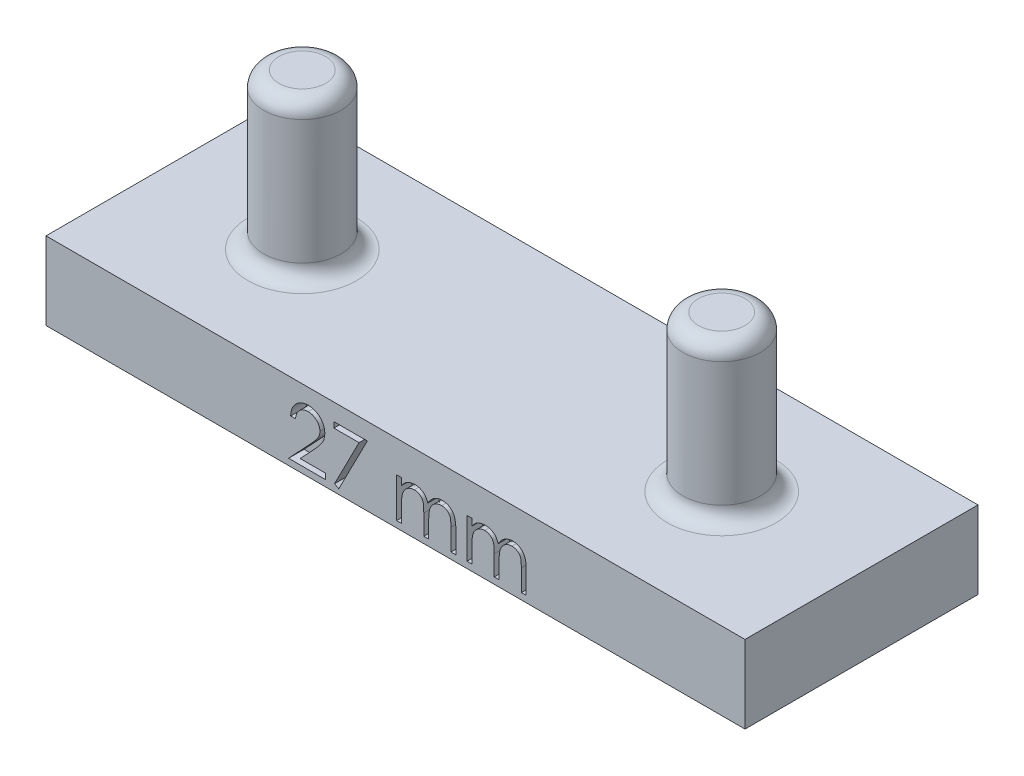
from build123d import *

# Parameters (mm, degrees)
SKETCH1_R             = 2.5
BOSS_EXTRUDE1_DEPTH   = 10
BOSS_EXTRUDE1_2_DEPTH = 10
SKETCH2_W             = 45
SKETCH2_H             = 15
BOSS_EXTRUDE2_DEPTH   = 5
CUT_EXTRUDE1_DEPTH    = 1
FILLET1_R             = 1


with BuildPart() as part:
    # Sketch1 → Boss-Extrude1 (new body)
    with BuildSketch(Plane(origin=(0, 0, 0), x_dir=(1, 0, 0), z_dir=(0, 1, 0))):
        with Locations((-41.821276596, 3.10212766)):
            Circle(SKETCH1_R)
    extrude(amount=BOSS_EXTRUDE1_DEPTH)



with BuildPart() as body_2:
    # Sketch1 → Boss-Extrude1 2 (new body)
    with BuildSketch(Plane(origin=(0, 0, 0), x_dir=(1, 0, 0), z_dir=(0, 1, 0))):
        with Locations((-14.821276596, 3.10212766)):
            Circle(SKETCH1_R)
    extrude(amount=BOSS_EXTRUDE1_2_DEPTH)


with BuildPart() as part_1:
    add(part.part)

    add(body_2.part)  # Boss-Extrude2 merges body 2
    # Sketch2 → Boss-Extrude2 (add)
    with BuildSketch(Plane.XZ):
        with Locations((-28.321276596, -3.10212766)):
            Rectangle(SKETCH2_W, SKETCH2_H)
    extrude(amount=BOSS_EXTRUDE2_DEPTH)

    # Sketch3 → Cut-Extrude1 (cut)
    with BuildSketch(Plane.XY.offset(4.39787234)):
        with BuildLine():
            Line((-23.718209968, -2.034062219), (-23.404107404, -2.034062219))
            Line((-23.404107404, -2.034062219), (-23.404107404, -2.478573436))
            add(Edge.make_bspline(
                [(-23.404107404, -2.478573436), (-23.375823454, -2.439685835), (-23.321628694, -2.365173462), (-23.232763042, -2.266983177), (-23.143986929, -2.183655023), (-23.080053547, -2.139912151), (-23.049339775, -2.118897956)],
                knots=[0, 0, 0, 0, 1.134379233, 2.173579362, 3.122582517, 4, 4, 4, 4], degree=3))
            add(Edge.make_bspline(
                [(-23.049339775, -2.118897956), (-23.007475113, -2.09889259), (-22.924477214, -2.059231377), (-22.793057989, -2.018997818), (-22.658583319, -1.994272717), (-22.567775105, -1.990891343), (-22.522096186, -1.989190424)],
                knots=[0, 0, 0, 0, 1.014936303, 2.012140481, 3.000054389, 4, 4, 4, 4], degree=3))
            add(Edge.make_bspline(
                [(-22.522096186, -1.989190424), (-22.491203189, -1.990235714), (-22.43006761, -1.992304289), (-22.33948352, -2.005764324), (-22.251624908, -2.029030497), (-22.167010879, -2.061437821), (-22.0872902, -2.100684508), (-22.014201002, -2.146734216), (-21.948576794, -2.198431291), (-21.890450742, -2.258110224), (-21.838181717, -2.327446823), (-21.79010287, -2.408311072), (-21.745677658, -2.502518733), (-21.721056349, -2.570885274), (-21.708093782, -2.606878725)],
                knots=[0, 0, 0, 0, 1.009824226, 1.998387844, 2.986035974, 3.974953746, 4.955485308, 5.885931332, 6.793869504, 7.679848016, 8.601185859, 9.625726857, 10.749998409, 12, 12, 12, 12], degree=3))
            add(Edge.make_bspline(
                [(-21.708093782, -2.606878725), (-21.69438253, -2.582154306), (-21.667400713, -2.533500121), (-21.622095076, -2.464641858), (-21.57462728, -2.400235067), (-21.524592787, -2.340228642), (-21.4721682, -2.284918912), (-21.4171068, -2.23412301), (-21.359722018, -2.187622797), (-21.279929778, -2.133299637), (-21.176117171, -2.075598456), (-21.045229056, -2.025570012), (-20.909078885, -1.994653883), (-20.816661186, -1.99102361), (-20.76999282, -1.989190424)],
                knots=[0, 0, 0, 0, 0.86119277, 1.694706429, 2.50939023, 3.298075842, 4.073795165, 4.829715201, 5.57930267, 6.321991688, 7.768977793, 9.186738141, 10.579381044, 12, 12, 12, 12], degree=3))
            add(Edge.make_bspline(
                [(-20.76999282, -1.989190424), (-20.727111357, -1.990807645), (-20.643188171, -1.993972703), (-20.521010906, -2.018826176), (-20.4070691, -2.061503823), (-20.301592024, -2.11973746), (-20.206432211, -2.192916643), (-20.123715901, -2.279985481), (-20.053945538, -2.380328104), (-20.008366898, -2.474720092), (-19.977451634, -2.558055425), (-19.9583904, -2.629061717), (-19.941550705, -2.707213269), (-19.92756946, -2.792603531), (-19.917350907, -2.885534139), (-19.909780192, -2.985853015), (-19.904656118, -3.093638127), (-19.904294046, -3.168003627), (-19.904107404, -3.20633786)],
                knots=[0, 0, 0, 0, 1.209669288, 2.367440248, 3.500751976, 4.631527125, 5.755587489, 6.87532382, 8.007944318, 9.190864318, 9.82315674, 10.514484317, 11.263564316, 12.079023757, 12.955305781, 13.901327259, 14.918167583, 16, 16, 16, 16], degree=3))
            Line((-19.904107404, -3.20633786), (-19.904107404, -4.591754526))
            Line((-19.904107404, -4.591754526), (-20.218209968, -4.591754526))
            Line((-20.218209968, -4.591754526), (-20.218209968, -3.204935616))
            add(Edge.make_bspline(
                [(-20.218209968, -3.204935616), (-20.218287851, -3.172215042), (-20.21843753, -3.109331075), (-20.221131162, -3.019078624), (-20.226206476, -2.936810267), (-20.232141114, -2.862638179), (-20.240384924, -2.79638939), (-20.251030855, -2.738196972), (-20.262308535, -2.68760316), (-20.281044526, -2.631517113), (-20.310992418, -2.569646902), (-20.356609898, -2.502923326), (-20.414080004, -2.444842526), (-20.480440161, -2.394424209), (-20.555988606, -2.353430568), (-20.639253329, -2.324154558), (-20.72971738, -2.30603168), (-20.792340169, -2.304225665), (-20.82468032, -2.303292988)],
                knots=[0, 0, 0, 0, 1.253487763, 2.409012846, 3.458416907, 4.410876679, 5.259312806, 6.014470957, 6.676830364, 7.243083969, 8.276244668, 9.299465089, 10.325150304, 11.392391894, 12.482080715, 13.603491619, 14.762376348, 16, 16, 16, 16], degree=3))
            add(Edge.make_bspline(
                [(-20.82468032, -2.303292988), (-20.864350275, -2.304709145), (-20.942753186, -2.307508011), (-21.057198672, -2.336081884), (-21.167169689, -2.379162134), (-21.269384822, -2.441594591), (-21.363412612, -2.516402955), (-21.44431219, -2.605352551), (-21.511144376, -2.705982478), (-21.556398352, -2.79912918), (-21.584987653, -2.882798624), (-21.603864569, -2.955895996), (-21.61854796, -3.038977564), (-21.632318489, -3.131485055), (-21.641306217, -3.234055235), (-21.64947459, -3.346213636), (-21.653295452, -3.468297596), (-21.653829911, -3.552924284), (-21.654107404, -3.596862699)],
                knots=[0, 0, 0, 0, 1.090531906, 2.155305635, 3.229839962, 4.33261226, 5.44038871, 6.529323825, 7.629011124, 8.757537029, 9.370236727, 10.061839251, 10.834451254, 11.692844982, 12.636905849, 13.66920014, 14.789842145, 16, 16, 16, 16], degree=3))
            Line((-21.654107404, -3.596862699), (-21.654107404, -4.591754526))
            Line((-21.654107404, -4.591754526), (-21.968209968, -4.591754526))
            Line((-21.968209968, -4.591754526), (-21.968209968, -3.291173597))
            add(Edge.make_bspline(
                [(-21.968209968, -3.291173597), (-21.968289399, -3.254480278), (-21.968442216, -3.183886021), (-21.971118533, -3.082652345), (-21.976205155, -2.990571265), (-21.982085703, -2.907749802), (-21.990545882, -2.834338473), (-22.000155644, -2.769943715), (-22.011504254, -2.714726964), (-22.030294139, -2.654163579), (-22.059008607, -2.587442656), (-22.105196869, -2.516301635), (-22.16280445, -2.454033537), (-22.230375326, -2.400874789), (-22.306381008, -2.356933307), (-22.390364409, -2.325273556), (-22.481569321, -2.306849266), (-22.544447027, -2.304500769), (-22.576783686, -2.303292988)],
                knots=[0, 0, 0, 0, 1.320475261, 2.540461679, 3.643808994, 4.639130445, 5.527981419, 6.302341397, 6.981980563, 7.553956391, 8.582137848, 9.585246428, 10.591171744, 11.620968678, 12.668337649, 13.738356861, 14.836885341, 16, 16, 16, 16], degree=3))
            add(Edge.make_bspline(
                [(-22.576783686, -2.303292988), (-22.614799897, -2.304823448), (-22.690564857, -2.3078736), (-22.801866826, -2.335327874), (-22.90935251, -2.378331949), (-23.011307209, -2.437991768), (-23.104981357, -2.511890847), (-23.186989624, -2.598805742), (-23.25593215, -2.697654776), (-23.301663965, -2.789819292), (-23.331162439, -2.871392567), (-23.350757773, -2.940743515), (-23.367597399, -3.017743763), (-23.380111421, -3.102630874), (-23.392191837, -3.194851968), (-23.398022146, -3.294866458), (-23.403693708, -3.402588546), (-23.403966123, -3.476961091), (-23.404107404, -3.515532571)],
                knots=[0, 0, 0, 0, 1.098833095, 2.189935336, 3.297829714, 4.440610912, 5.596351641, 6.740013378, 7.886572111, 9.072425424, 9.705826452, 10.395263256, 11.156850408, 11.985370555, 12.878090359, 13.847760091, 14.883794034, 16, 16, 16, 16], degree=3))
            Line((-23.404107404, -3.515532571), (-23.404107404, -4.591754526))
            Line((-23.404107404, -4.591754526), (-23.718209968, -4.591754526))
            Line((-23.718209968, -4.591754526), (-23.718209968, -2.034062219))
        make_face()
        with BuildLine():
            Line((-28.25026125, -2.034062219), (-27.936158686, -2.034062219))
            Line((-27.936158686, -2.034062219), (-27.936158686, -2.478573436))
            add(Edge.make_bspline(
                [(-27.936158686, -2.478573436), (-27.907874736, -2.439685835), (-27.853679976, -2.365173462), (-27.764814324, -2.266983177), (-27.676038211, -2.183655023), (-27.612104829, -2.139912151), (-27.581391057, -2.118897956)],
                knots=[0, 0, 0, 0, 1.134379233, 2.173579362, 3.122582517, 4, 4, 4, 4], degree=3))
            add(Edge.make_bspline(
                [(-27.581391057, -2.118897956), (-27.539526395, -2.09889259), (-27.456528496, -2.059231377), (-27.325109271, -2.018997818), (-27.190634601, -1.994272717), (-27.099826387, -1.990891343), (-27.054147468, -1.989190424)],
                knots=[0, 0, 0, 0, 1.014936303, 2.012140481, 3.000054389, 4, 4, 4, 4], degree=3))
            add(Edge.make_bspline(
                [(-27.054147468, -1.989190424), (-27.023254471, -1.990235714), (-26.962118892, -1.992304289), (-26.871534802, -2.005764324), (-26.78367619, -2.029030497), (-26.699062161, -2.061437821), (-26.619341482, -2.100684508), (-26.546252284, -2.146734216), (-26.480628076, -2.198431291), (-26.422502024, -2.258110224), (-26.370232999, -2.327446823), (-26.322154152, -2.408311072), (-26.27772894, -2.502518733), (-26.253107631, -2.570885274), (-26.240145064, -2.606878725)],
                knots=[0, 0, 0, 0, 1.009824226, 1.998387844, 2.986035974, 3.974953746, 4.955485308, 5.885931332, 6.793869504, 7.679848016, 8.601185859, 9.625726857, 10.749998409, 12, 12, 12, 12], degree=3))
            add(Edge.make_bspline(
                [(-26.240145064, -2.606878725), (-26.226433813, -2.582154306), (-26.199451995, -2.533500121), (-26.154146358, -2.464641858), (-26.106678562, -2.400235067), (-26.056644069, -2.340228642), (-26.004219482, -2.284918912), (-25.949158082, -2.23412301), (-25.8917733, -2.187622797), (-25.81198106, -2.133299637), (-25.708168453, -2.075598456), (-25.577280338, -2.025570012), (-25.441130167, -1.994653883), (-25.348712468, -1.99102361), (-25.302044102, -1.989190424)],
                knots=[0, 0, 0, 0, 0.86119277, 1.694706429, 2.50939023, 3.298075842, 4.073795165, 4.829715201, 5.57930267, 6.321991688, 7.768977793, 9.186738141, 10.579381044, 12, 12, 12, 12], degree=3))
            add(Edge.make_bspline(
                [(-25.302044102, -1.989190424), (-25.25916264, -1.990807645), (-25.175239453, -1.993972703), (-25.053062188, -2.018826176), (-24.939120382, -2.061503823), (-24.833643306, -2.11973746), (-24.738483493, -2.192916643), (-24.655767184, -2.279985481), (-24.58599682, -2.380328104), (-24.54041818, -2.474720092), (-24.509502916, -2.558055425), (-24.490441682, -2.629061717), (-24.473601987, -2.707213269), (-24.459620742, -2.792603531), (-24.449402189, -2.885534139), (-24.441831474, -2.985853015), (-24.4367074, -3.093638127), (-24.436345328, -3.168003627), (-24.436158686, -3.20633786)],
                knots=[0, 0, 0, 0, 1.209669288, 2.367440248, 3.500751976, 4.631527125, 5.755587489, 6.87532382, 8.007944318, 9.190864318, 9.82315674, 10.514484317, 11.263564316, 12.079023757, 12.955305781, 13.901327259, 14.918167583, 16, 16, 16, 16], degree=3))
            Line((-24.436158686, -3.20633786), (-24.436158686, -4.591754526))
            Line((-24.436158686, -4.591754526), (-24.75026125, -4.591754526))
            Line((-24.75026125, -4.591754526), (-24.75026125, -3.204935616))
            add(Edge.make_bspline(
                [(-24.75026125, -3.204935616), (-24.750339133, -3.172215042), (-24.750488812, -3.109331075), (-24.753182444, -3.019078624), (-24.758257758, -2.936810267), (-24.764192396, -2.862638179), (-24.772436206, -2.79638939), (-24.783082138, -2.738196972), (-24.794359817, -2.68760316), (-24.813095809, -2.631517113), (-24.8430437, -2.569646902), (-24.88866118, -2.502923326), (-24.946131286, -2.444842526), (-25.012491443, -2.394424209), (-25.088039888, -2.353430568), (-25.171304611, -2.324154558), (-25.261768662, -2.30603168), (-25.324391451, -2.304225665), (-25.356731602, -2.303292988)],
                knots=[0, 0, 0, 0, 1.253487763, 2.409012846, 3.458416907, 4.410876679, 5.259312806, 6.014470957, 6.676830364, 7.243083969, 8.276244668, 9.299465089, 10.325150304, 11.392391894, 12.482080715, 13.603491619, 14.762376348, 16, 16, 16, 16], degree=3))
            add(Edge.make_bspline(
                [(-25.356731602, -2.303292988), (-25.396401557, -2.304709145), (-25.474804468, -2.307508011), (-25.589249954, -2.336081884), (-25.699220971, -2.379162134), (-25.801436104, -2.441594591), (-25.895463894, -2.516402955), (-25.976363472, -2.605352551), (-26.043195658, -2.705982478), (-26.088449634, -2.79912918), (-26.117038935, -2.882798624), (-26.135915851, -2.955895996), (-26.150599242, -3.038977564), (-26.164369771, -3.131485055), (-26.173357499, -3.234055235), (-26.181525872, -3.346213636), (-26.185346734, -3.468297596), (-26.185881193, -3.552924284), (-26.186158686, -3.596862699)],
                knots=[0, 0, 0, 0, 1.090531906, 2.155305635, 3.229839962, 4.33261226, 5.44038871, 6.529323825, 7.629011124, 8.757537029, 9.370236727, 10.061839251, 10.834451254, 11.692844982, 12.636905849, 13.66920014, 14.789842145, 16, 16, 16, 16], degree=3))
            Line((-26.186158686, -3.596862699), (-26.186158686, -4.591754526))
            Line((-26.186158686, -4.591754526), (-26.50026125, -4.591754526))
            Line((-26.50026125, -4.591754526), (-26.50026125, -3.291173597))
            add(Edge.make_bspline(
                [(-26.50026125, -3.291173597), (-26.500340681, -3.254480278), (-26.500493498, -3.183886021), (-26.503169815, -3.082652345), (-26.508256437, -2.990571265), (-26.514136985, -2.907749802), (-26.522597164, -2.834338473), (-26.532206926, -2.769943715), (-26.543555537, -2.714726964), (-26.562345421, -2.654163579), (-26.591059889, -2.587442656), (-26.637248151, -2.516301635), (-26.694855732, -2.454033537), (-26.762426608, -2.400874789), (-26.83843229, -2.356933307), (-26.922415691, -2.325273556), (-27.013620603, -2.306849266), (-27.076498309, -2.304500769), (-27.108834968, -2.303292988)],
                knots=[0, 0, 0, 0, 1.320475261, 2.540461679, 3.643808994, 4.639130445, 5.527981419, 6.302341397, 6.981980563, 7.553956391, 8.582137848, 9.585246428, 10.591171744, 11.620968678, 12.668337649, 13.738356861, 14.836885341, 16, 16, 16, 16], degree=3))
            add(Edge.make_bspline(
                [(-27.108834968, -2.303292988), (-27.146851179, -2.304823448), (-27.222616139, -2.3078736), (-27.333918108, -2.335327874), (-27.441403792, -2.378331949), (-27.543358491, -2.437991768), (-27.637032639, -2.511890847), (-27.719040906, -2.598805742), (-27.787983432, -2.697654776), (-27.833715247, -2.789819292), (-27.863213721, -2.871392567), (-27.882809055, -2.940743515), (-27.899648681, -3.017743763), (-27.912162703, -3.102630874), (-27.924243119, -3.194851968), (-27.930073428, -3.294866458), (-27.93574499, -3.402588546), (-27.936017405, -3.476961091), (-27.936158686, -3.515532571)],
                knots=[0, 0, 0, 0, 1.098833095, 2.189935336, 3.297829714, 4.440610912, 5.596351641, 6.740013378, 7.886572111, 9.072425424, 9.705826452, 10.395263256, 11.156850408, 11.985370555, 12.878090359, 13.847760091, 14.883794034, 16, 16, 16, 16], degree=3))
            Line((-27.936158686, -3.515532571), (-27.936158686, -4.591754526))
            Line((-27.936158686, -4.591754526), (-28.25026125, -4.591754526))
            Line((-28.25026125, -4.591754526), (-28.25026125, -2.034062219))
        make_face()
        Polygon((-32.288722788, -1.091754526), (-30.134876634, -1.091754526), (-31.974620224, -4.681498116), (-32.245954359, -4.532159174), (-30.666326955, -1.450728885), (-32.288722788, -1.450728885), align=None)
        with BuildLine():
            Line((-34.756671506, -2.168677603), (-35.07077407, -2.168677603))
            add(Edge.make_bspline(
                [(-35.07077407, -2.168677603), (-35.068726917, -2.127006715), (-35.064706363, -2.045166201), (-35.045878074, -1.925842294), (-35.018937197, -1.811787496), (-34.980845743, -1.703917582), (-34.933539465, -1.601278774), (-34.876809438, -1.504278759), (-34.809615587, -1.41328757), (-34.733408853, -1.329148727), (-34.650640214, -1.251961156), (-34.561334275, -1.185305913), (-34.467489247, -1.128988242), (-34.369389848, -1.081907), (-34.265929285, -1.046567154), (-34.158046427, -1.020345514), (-34.04526729, -1.004569169), (-33.968427268, -1.002873383), (-33.929347788, -1.002010936)],
                knots=[0, 0, 0, 0, 1.10065271, 2.161652631, 3.183658789, 4.190468796, 5.17591951, 6.163126047, 7.15150782, 8.156236427, 9.156009102, 10.134482811, 11.092018607, 12.041330605, 13.001268258, 13.972401359, 14.968799086, 16, 16, 16, 16], degree=3))
            add(Edge.make_bspline(
                [(-33.929347788, -1.002010936), (-33.890969714, -1.002909393), (-33.81555817, -1.004674828), (-33.705496155, -1.019835857), (-33.600718861, -1.043581449), (-33.501431094, -1.076896865), (-33.40842503, -1.121681292), (-33.321001985, -1.175478831), (-33.238121174, -1.237698662), (-33.163514391, -1.310952476), (-33.095006311, -1.38915486), (-33.035904056, -1.472642764), (-32.985290893, -1.55887205), (-32.943103213, -1.648500251), (-32.912047074, -1.74237128), (-32.888468866, -1.839118482), (-32.875141452, -1.939743293), (-32.873096029, -2.007849849), (-32.872056122, -2.04247568)],
                knots=[0, 0, 0, 0, 1.111607364, 2.184268762, 3.212621178, 4.221274766, 5.211760367, 6.196651075, 7.1921475, 8.207485113, 9.220403448, 10.201281604, 11.166441695, 12.114753415, 13.065576456, 14.026450734, 14.996634279, 16, 16, 16, 16], degree=3))
            add(Edge.make_bspline(
                [(-32.872056122, -2.04247568), (-32.873749384, -2.091223515), (-32.877106196, -2.187863728), (-32.905820572, -2.329878591), (-32.950667083, -2.46747201), (-33.00466444, -2.578209312), (-33.059136884, -2.667442806), (-33.108224392, -2.740911511), (-33.165689203, -2.820016979), (-33.232367701, -2.904494317), (-33.306880573, -2.995005222), (-33.389902736, -3.091495017), (-33.482026218, -3.192966787), (-33.546684719, -3.262272388), (-33.580189134, -3.298184815)],
                knots=[0, 0, 0, 0, 1.184426356, 2.348067706, 3.509069118, 4.696110526, 5.333549288, 6.050745305, 6.844228056, 7.710549037, 8.667450064, 9.695053472, 10.805634456, 12, 12, 12, 12], degree=3))
            Line((-33.580189134, -3.298184815), (-34.455890256, -4.232780167))
            Line((-34.455890256, -4.232780167), (-32.827184327, -4.232780167))
            Line((-32.827184327, -4.232780167), (-32.827184327, -4.591754526))
            Line((-32.827184327, -4.591754526), (-35.205389455, -4.591754526))
            Line((-35.205389455, -4.591754526), (-33.84801766, -3.143236898))
            add(Edge.make_bspline(
                [(-33.84801766, -3.143236898), (-33.814969773, -3.108738591), (-33.751491546, -3.042474405), (-33.661708969, -2.945731445), (-33.581069981, -2.855981904), (-33.509052588, -2.773395356), (-33.447219083, -2.696763788), (-33.392346851, -2.628569084), (-33.34838126, -2.565814634), (-33.300665864, -2.49307402), (-33.254451883, -2.404261703), (-33.214739527, -2.295728014), (-33.190524678, -2.184000761), (-33.187619843, -2.108498724), (-33.186158686, -2.070520552)],
                knots=[0, 0, 0, 0, 1.329631726, 2.553950428, 3.673215718, 4.687767853, 5.603093632, 6.413772471, 7.123043292, 7.734684054, 8.834405432, 9.900288307, 10.943827018, 12, 12, 12, 12], degree=3))
            add(Edge.make_bspline(
                [(-33.186158686, -2.070520552), (-33.186794428, -2.046639153), (-33.188047354, -1.999573503), (-33.199105051, -1.930567744), (-33.215815558, -1.86400293), (-33.239760816, -1.799674311), (-33.271367556, -1.738228659), (-33.309840936, -1.679591179), (-33.354230999, -1.622902214), (-33.405582268, -1.569748916), (-33.461993788, -1.52106771), (-33.521588038, -1.477943625), (-33.584638142, -1.441904514), (-33.650878264, -1.412361017), (-33.720123734, -1.389185636), (-33.792508479, -1.373127056), (-33.867832495, -1.363044572), (-33.919265991, -1.3616804), (-33.94547359, -1.360985295)],
                knots=[0, 0, 0, 0, 0.991446411, 1.95395049, 2.89581595, 3.838931463, 4.798493298, 5.75982156, 6.748411868, 7.785213223, 8.824556874, 9.840280684, 10.836137867, 11.835679398, 12.848801643, 13.863922112, 14.911575587, 16, 16, 16, 16], degree=3))
            add(Edge.make_bspline(
                [(-33.94547359, -1.360985295), (-33.972844422, -1.361700328), (-34.026596219, -1.363104533), (-34.105515251, -1.372927197), (-34.180801029, -1.389873037), (-34.252642932, -1.413049712), (-34.321162518, -1.442508261), (-34.386026562, -1.479200005), (-34.447089451, -1.522983498), (-34.504465974, -1.572624055), (-34.557329953, -1.627891656), (-34.603776829, -1.689501619), (-34.644360843, -1.756329034), (-34.679770077, -1.828193585), (-34.708525767, -1.905747365), (-34.730498917, -1.98871507), (-34.747885764, -2.076736451), (-34.753694285, -2.137521536), (-34.756671506, -2.168677603)],
                knots=[0, 0, 0, 0, 1.031018746, 2.02475058, 2.990194455, 3.934040569, 4.864654155, 5.795059489, 6.735614925, 7.690564532, 8.649604399, 9.611025574, 10.590972636, 11.591080095, 12.624614302, 13.701020113, 14.821632451, 16, 16, 16, 16], degree=3))
        make_face()
    extrude(amount=-CUT_EXTRUDE1_DEPTH, mode=Mode.SUBTRACT)

    # Fillet1
    fillet1_edges = [part_1.edges().sort_by_distance(p)[0] for p in [
        (-44.321276596, 0, -3.10212766),
        (-17.321276596, 0, -3.10212766),
        (-17.321276596, 10, -3.10212766),
        (-44.321276596, 10, -3.10212766),
    ]]
    fillet(fillet1_edges, radius=FILLET1_R)


solid = part_1.part
